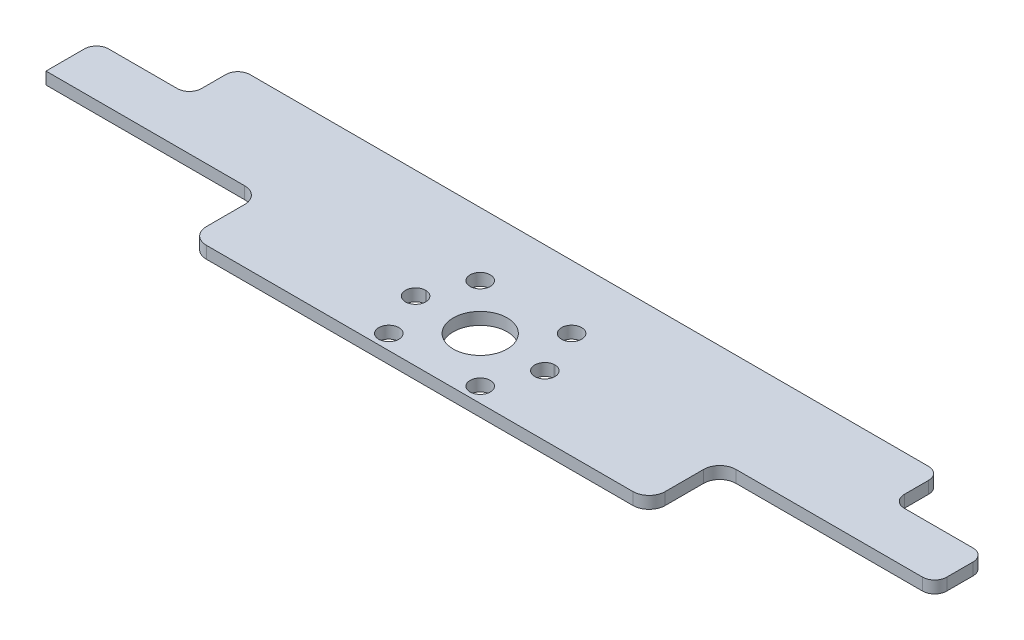
from build123d import *

# Parameters (mm, degrees)
SKETCH_2_R      = 2.5
SKETCH_2_R_2    = 6.682030953
EXTRUDE_1_DEPTH = 3
FILLET_1_R      = 4
FILLET_2_R      = 3


with BuildPart() as part:
    # 草图2 → 凸台-拉伸1 (new body)
    with BuildSketch(Plane(origin=(0, 0, 0), x_dir=(1, 0, 0), z_dir=(0, 1, 0))):
        Polygon((56.805521657, -9.248304321), (110, -9.248304321), (110, 3.251695679), (87, 3.251695679), (87, 15.251695679), (-87, 15.251695679), (-87, 3.251695679), (-110, 3.251695679), (-110, -9.248304321), (-56.805521657, -9.248304321), (-56.805521657, -26.748304321), (56.805521657, -26.748304321), align=None)
        with BuildLine():
            Line((15.803480629, -9.248304321), (16, -9.248304321))
            ThreePointArc((16, -9.248304321), (16.097730955, -14.246393323), (15.8046875, -9.255945393))
            ThreePointArc((15.8046875, -9.255945393), (15.804084526, -9.252124784), (15.803480629, -9.248304321))
        make_face(mode=Mode.SUBTRACT)
        with Locations((11.313708499, -0.434595822)):
            Circle(SKETCH_2_R, mode=Mode.SUBTRACT)
        with Locations((11.313708499, -23.06201282)):
            Circle(SKETCH_2_R, mode=Mode.SUBTRACT)
        with Locations((0, -11.748304321)):
            Circle(SKETCH_2_R_2, mode=Mode.SUBTRACT)
        with Locations((-11.3137085, -0.434595822)):
            Circle(SKETCH_2_R, mode=Mode.SUBTRACT)
        with BuildLine():
            Line((-15.999999978, -9.248304321), (-15.803480629, -9.248304321))
            ThreePointArc((-15.803480629, -9.248304321), (-15.804084526, -9.252124784), (-15.8046875, -9.255945394))
            ThreePointArc((-15.8046875, -9.255945394), (-16.097730968, -14.246393322), (-15.999999978, -9.248304322))
        make_face(mode=Mode.SUBTRACT)
        with Locations((-11.313708499, -23.062012821)):
            Circle(SKETCH_2_R, mode=Mode.SUBTRACT)
    extrude(amount=EXTRUDE_1_DEPTH)

    # 圆角1
    fillet_1_edges = [part.edges().sort_by_distance(p)[0] for p in [
        (56.805521657, 1.5, 9.248304321),
        (56.805521657, 1.5, 26.748304321),
        (-56.805521657, 1.5, 9.248304321),
        (-56.805521657, 1.5, 26.748304321),
    ]]
    fillet(fillet_1_edges, radius=FILLET_1_R)

    # 圆角2
    fillet_2_edges = [part.edges().sort_by_distance(p)[0] for p in [
        (-110, 1.5, -3.251695679),
        (-87, 1.5, -3.251695679),
        (-87, 1.5, -15.251695679),
        (110, 1.5, 9.248304321),
        (110, 1.5, -3.251695679),
        (87, 1.5, -3.251695679),
        (87, 1.5, -15.251695679),
    ]]
    fillet(fillet_2_edges, radius=FILLET_2_R)


solid = part.part
